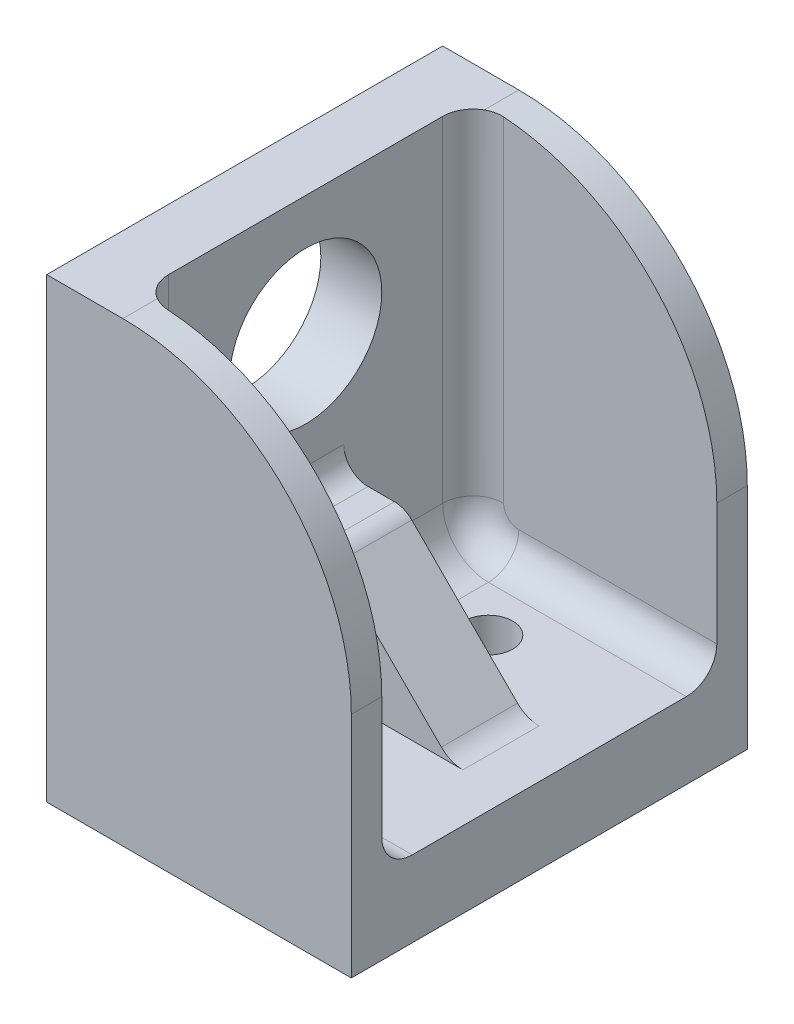
from build123d import *

# Parameters (mm, degrees)
EXTRUDE_1_DEPTH      = 13
EXTRUDE_1_DEPTH_BACK = 13
SKETCH_2_R           = 5
CUT_EXTRUDE_1_DEPTH  = 38.322915213
SKETCH_3_R           = 1.6
CUT_EXTRUDE_2_DEPTH  = 37.783148315
EXTRUDE_START        = 3
SKETCH_4_W           = 18
SKETCH_4_H           = 26
SKETCH_4_R           = 1.6
EXTRUDE_2_DEPTH      = 3
EXTRUDE_START_2      = 2
SKETCH_5_W           = 26
SKETCH_5_H           = 25
SKETCH_5_R           = 5
EXTRUDE_3_DEPTH      = 2
SKETCH_6_W           = 14
SKETCH_6_H           = 5
EXTRUDE_4_DEPTH      = 8
CHAMFER_1_SIZE       = 10
FILLET_1_R           = 3
EXTRUDE_5_REACH      = 36.554
SKETCH_7_W           = 16
SKETCH_7_H           = 2
FILLET_2_R           = 15
FILLET_3_R           = 2
FILLET_4_R           = 1.6


with BuildPart() as part:
    # 草图1 → 凸台-拉伸1 (new, two sides: drawn at the far end of the back side and taken through both)
    with BuildSketch(Plane.XY.offset(-EXTRUDE_1_DEPTH_BACK)):
        Polygon((0, 30), (0, 0), (20, 0), (20, 2), (2, 2), (2, 30), align=None)
    extrude(amount=EXTRUDE_1_DEPTH + EXTRUDE_1_DEPTH_BACK)

    # 草图2 → 切除-拉伸1 (cut, through all)
    with BuildSketch(Plane(origin=(2, 0, 0), x_dir=(0, 0, -1), z_dir=(1, 0, 0))):
        with Locations((0, 22)):
            Circle(SKETCH_2_R)
    extrude(amount=-CUT_EXTRUDE_1_DEPTH, mode=Mode.SUBTRACT)

    # 草图3 → 切除-拉伸2 (cut, through all)
    with BuildSketch(Plane(origin=(0, 2, 0), x_dir=(1, 0, 0), z_dir=(0, 1, 0))):
        with Locations(Location((10, 6, 0), (0, 0, 270))):
            Circle(SKETCH_3_R)
        with Locations(Location((10, -6, 0), (0, 0, 90))):
            Circle(SKETCH_3_R)
    extrude(amount=-CUT_EXTRUDE_2_DEPTH, mode=Mode.SUBTRACT)

    # 草图4 → 凸台-拉伸2 (add)
    with BuildSketch(Plane(origin=(0, 2, 0), x_dir=(1, 0, 0), z_dir=(0, 1, 0)).offset(EXTRUDE_START)):
        with Locations((11, 0)):
            Rectangle(SKETCH_4_W, SKETCH_4_H)
        with Locations(Location((10, -6, 0), (0, 0, 270))):
            Circle(SKETCH_4_R, mode=Mode.SUBTRACT)
        with Locations(Location((10, 6, 0), (0, 0, 270))):
            Circle(SKETCH_4_R, mode=Mode.SUBTRACT)
    extrude(amount=-EXTRUDE_2_DEPTH)

    # 草图5 → 凸台-拉伸3 (add)
    with BuildSketch(Plane(origin=(2, 0, 0), x_dir=(0, 0, -1), z_dir=(1, 0, 0)).offset(EXTRUDE_START_2)):
        with Locations((0, 17.5)):
            Rectangle(SKETCH_5_W, SKETCH_5_H)
        with Locations((0, 22)):
            Circle(SKETCH_5_R, mode=Mode.SUBTRACT)
    extrude(amount=-EXTRUDE_3_DEPTH)

    # 草图6 → 凸台-拉伸4 (add)
    with BuildSketch(Plane(origin=(0, 5, 0), x_dir=(1, 0, 0), z_dir=(0, 1, 0))):
        with Locations((11, 0)):
            Rectangle(SKETCH_6_W, SKETCH_6_H)
    extrude(amount=EXTRUDE_4_DEPTH)

    # 倒角1
    # the kernel refuses this chamfer: 10 mm, written as the material it takes off along each edge
    with BuildSketch(Plane(origin=(18, 13, -28.21682988), x_dir=(-0.9996219169112968, 0.027495876610586317, 0), z_dir=(0, 0, 1))) as chamfer_1_piece_1_section:
        Polygon((CHAMFER_1_SIZE * 0.999621916911, CHAMFER_1_SIZE * 0.0274958766106), (-CHAMFER_1_SIZE * 0.0274958766106, CHAMFER_1_SIZE * 0.999621916911), (0, 0), align=None)
    chamfer_1_piece_1 = extrude(amount=56.433659759, mode=Mode.PRIVATE)
    chamfer_1_piece_1 = split(chamfer_1_piece_1, bisect_by=Plane(origin=(14.542815877, 5, 0), z_dir=(0, 1, 0)), keep=Keep.TOP, mode=Mode.PRIVATE)
    add(chamfer_1_piece_1, mode=Mode.SUBTRACT)

    # 圆角1
    fillet_1_edges = [part.edges().sort_by_distance(p)[0] for p in [
        (4, 5, 7.75),
        (4, 5, -7.75),
    ]]
    fillet(fillet_1_edges, radius=FILLET_1_R)

    # 凸台-拉伸5: up to this face of the body (flat: up to its plane)
    extrude_5_end = Plane(part.part.faces().sort_by_distance((2, 30, 0))[0])
    # 草图7 → 凸台-拉伸5 (add, up to the picked face)
    with BuildSketch(Plane(origin=(0, 5, 0), x_dir=(1, 0, 0), z_dir=(0, 1, 0)), mode=Mode.PRIVATE) as extrude_5_sk1:
        with Locations((12, 12)):
            Rectangle(SKETCH_7_W, SKETCH_7_H)
    extrude_5_tool1 = split(extrude(extrude_5_sk1.sketch, amount=EXTRUDE_5_REACH, mode=Mode.PRIVATE), bisect_by=extrude_5_end, keep=Keep.BOTH, mode=Mode.PRIVATE)
    # 草图7 → 凸台-拉伸5 (add, up to the picked face)
    with BuildSketch(Plane(origin=(0, 5, 0), x_dir=(1, 0, 0), z_dir=(0, 1, 0)), mode=Mode.PRIVATE) as extrude_5_sk2:
        with Locations((12, -12)):
            Rectangle(SKETCH_7_W, SKETCH_7_H)
    extrude_5_tool2 = split(extrude(extrude_5_sk2.sketch, amount=EXTRUDE_5_REACH, mode=Mode.PRIVATE), bisect_by=extrude_5_end, keep=Keep.BOTH, mode=Mode.PRIVATE)
    add(extrude_5_tool1.solids().sort_by(Axis((12, 5, -12), (0, 1, 0)))[0])
    add(extrude_5_tool2.solids().sort_by(Axis((12, 5, 12), (0, 1, 0)))[0])

    # 圆角2
    fillet_2_edges = [part.edges().sort_by_distance(p)[0] for p in [
        (20, 30, -12),
        (20, 30, 12),
    ]]
    fillet(fillet_2_edges, radius=FILLET_2_R)

    # 圆角3
    fillet_3_edges = [part.edges().sort_by_distance(p)[0] for p in [
        (13.5, 5, 11),
        (4.878679656, 5.878679656, 11),
        (13.5, 5, -11),
        (4.878679656, 5.878679656, -11),
        (16, 5, 0),
        (4, 19, 11),
        (4, 19, -11),
    ]]
    fillet(fillet_3_edges, radius=FILLET_3_R)

    # 圆角4
    fillet_4_edges = [part.edges().sort_by_distance(p)[0] for p in [
        (4, 13, 0),
        (8, 13, 0),
    ]]
    fillet(fillet_4_edges, radius=FILLET_4_R)


solid = part.part
